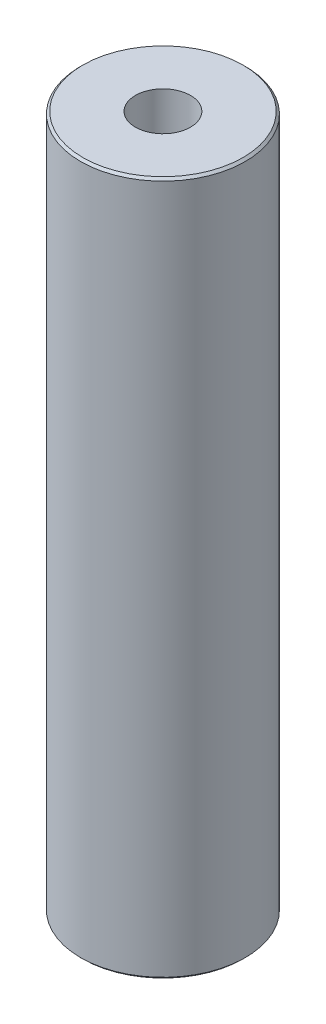
from build123d import *

# Parameters (mm, degrees)
SKETCH1_R           = 55
BOSS_EXTRUDE1_DEPTH = 463.253957148
SKETCH2_R           = 18.385456528
CUT_EXTRUDE1_DEPTH  = 470.738468526
CHAMFER1_SIZE       = 1.520901236


with BuildPart() as part:
    # Sketch1 → Boss-Extrude1 (new body)
    with BuildSketch(Plane(origin=(0, 0, 0), x_dir=(1, 0, 0), z_dir=(0, 1, 0))):
        Circle(SKETCH1_R)
    extrude(amount=BOSS_EXTRUDE1_DEPTH)

    # Sketch2 → Cut-Extrude1 (cut, through all)
    with BuildSketch(Plane(origin=(0, 0, 0), x_dir=(1, 0, 0), z_dir=(0, 1, 0))):
        Circle(SKETCH2_R)
    extrude(amount=CUT_EXTRUDE1_DEPTH, mode=Mode.SUBTRACT)

    # Chamfer1
    chamfer1_edges = [part.edges().sort_by_distance(p)[0] for p in [
        (-55, 463.253957148, 0),
        (-55, 0, 0),
    ]]
    chamfer(chamfer1_edges, length=CHAMFER1_SIZE)


solid = part.part
